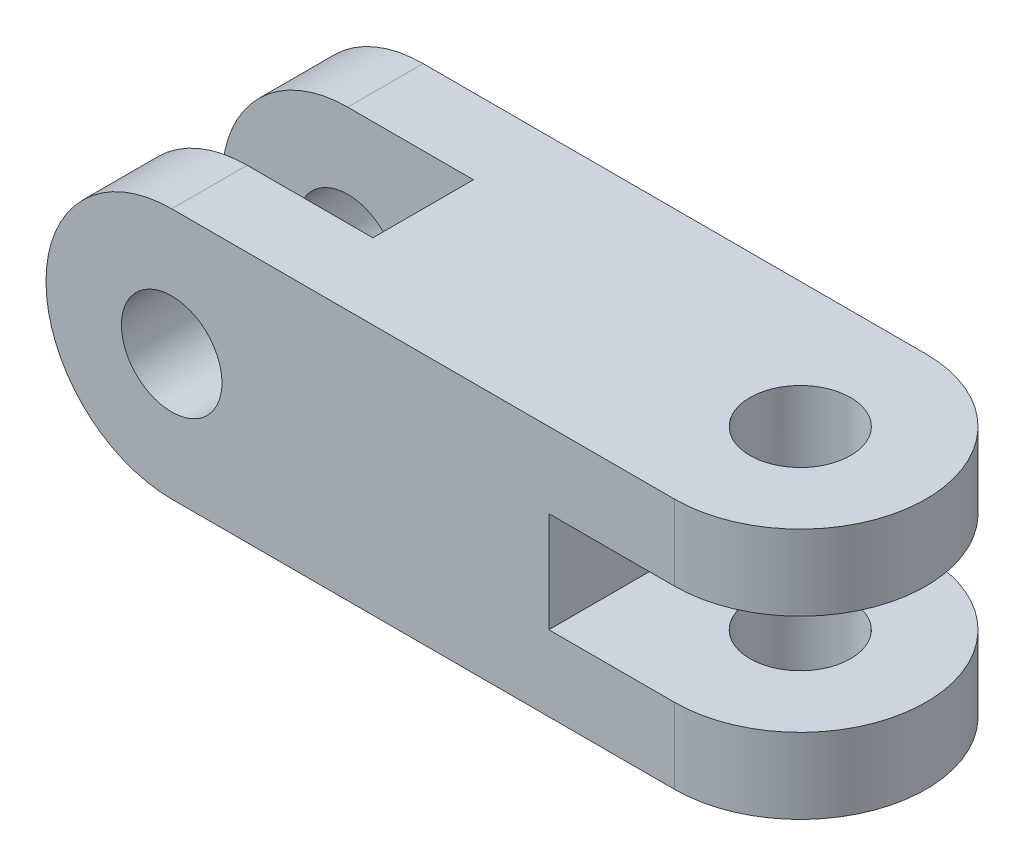
from build123d import *

# Parameters (mm, degrees)
SKETCH1_R           = 10
BOSS_EXTRUDE1_DEPTH = 50
SKETCH2_W           = 50
SKETCH2_H           = 20
CUT_EXTRUDE1_DEPTH  = 106.651549918
FILLET1_R           = 25
FILLET2_R           = 25
FILLET3_R           = 25
FILLET4_R           = 25
SKETCH3_R           = 10
CUT_EXTRUDE2_DEPTH  = 106.651549918


with BuildPart() as part:
    # Sketch1 → Boss-Extrude1 (new body)
    with BuildSketch(Plane(origin=(0, 0, 0), x_dir=(1, 0, 0), z_dir=(0, 1, 0))):
        with BuildLine():
            Line((-78.5, -15.188404139), (-78.5, -30.188404139))
            Line((-78.5, -30.188404139), (46.5, -30.188404139))
            ThreePointArc((46.5, -30.188404139), (71.5, -5.188404139), (46.5, 19.811595861))
            Line((46.5, 19.811595861), (-78.5, 19.811595861))
            Line((-78.5, 19.811595861), (-78.5, 4.811595861))
            Line((-78.5, 4.811595861), (-28.5, 4.811595861))
            Line((-28.5, 4.811595861), (-28.5, -15.188404139))
            Line((-28.5, -15.188404139), (-78.5, -15.188404139))
        make_face()
        with Locations(Location((46.5, -5.188404139, 0), (0, 0, 270))):
            Circle(SKETCH1_R, mode=Mode.SUBTRACT)
    extrude(amount=BOSS_EXTRUDE1_DEPTH)

    # Sketch2 → Cut-Extrude1 (cut, through all)
    with BuildSketch(Plane.XY.offset(30.188404139)):
        with Locations((46.5, 25)):
            Rectangle(SKETCH2_W, SKETCH2_H)
    extrude(amount=-CUT_EXTRUDE1_DEPTH, mode=Mode.SUBTRACT)

    # Fillet1
    fillet1_edges = [part.edges().sort_by_distance(p)[0] for p in [
        (-78.5, 0, -12.311595861),
    ]]
    fillet(fillet1_edges, radius=FILLET1_R)

    # Fillet2
    fillet2_edges = [part.edges().sort_by_distance(p)[0] for p in [
        (-78.5, 0, 22.688404139),
    ]]
    fillet(fillet2_edges, radius=FILLET2_R)

    # Fillet3
    fillet3_edges = [part.edges().sort_by_distance(p)[0] for p in [
        (-78.5, 50, 22.688404139),
    ]]
    fillet(fillet3_edges, radius=FILLET3_R - 0.0001)  # a hair under: the kernel refuses the full size

    # Fillet4
    fillet4_edges = [part.edges().sort_by_distance(p)[0] for p in [
        (-78.5, 50, -12.311595861),
    ]]
    fillet(fillet4_edges, radius=FILLET4_R - 0.0001)  # a hair under: the kernel refuses the full size

    # Sketch3 → Cut-Extrude2 (cut, through all)
    with BuildSketch(Plane(origin=(0, 0, -19.811595861), x_dir=(-1, 0, 0), z_dir=(0, 0, -1))):
        with Locations((53.5, 25)):
            Circle(SKETCH3_R)
    extrude(amount=-CUT_EXTRUDE2_DEPTH, mode=Mode.SUBTRACT)


solid = part.part
